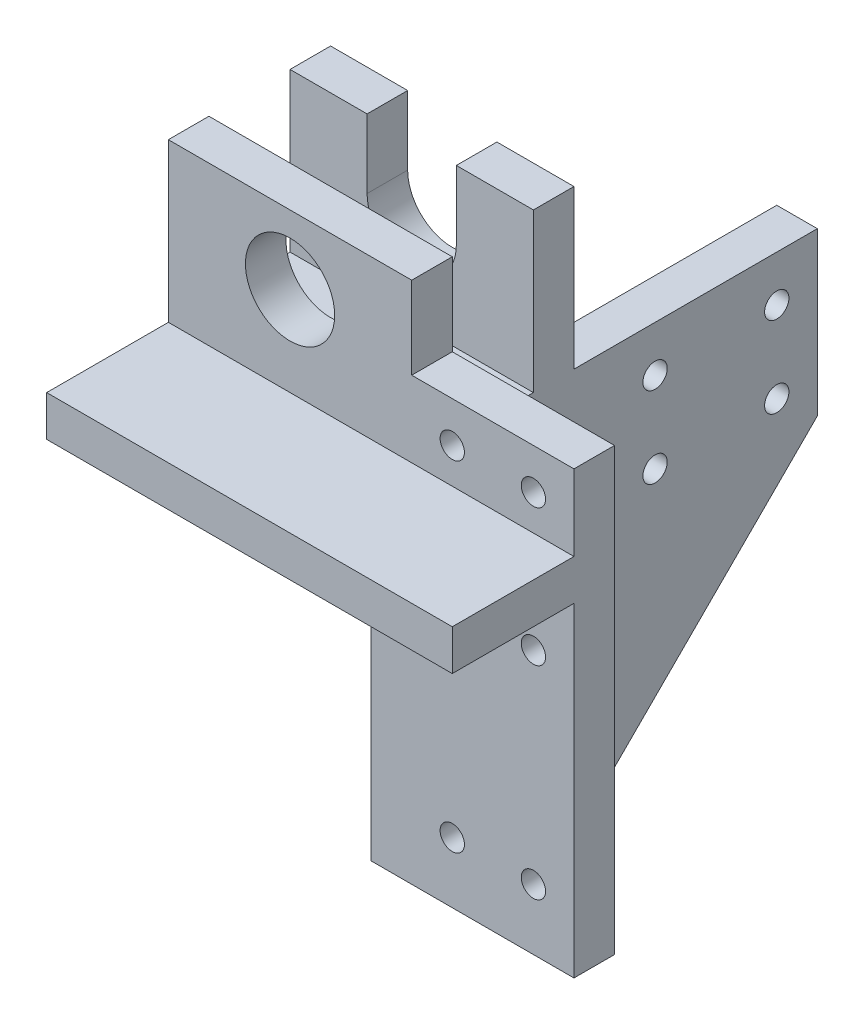
from build123d import *

# Parameters (mm, degrees)
BOSS_EXTRUDE1_DEPTH = 10
BOSS_EXTRUDE2_DEPTH = 80
SKETCH3_W           = 40
SKETCH3_H           = 10
BOSS_EXTRUDE3_DEPTH = 18.71
SKETCH4_W           = 10
SKETCH4_H           = 90
BOSS_EXTRUDE4_DEPTH = 50
CUT_EXTRUDE1_REACH  = 162.624
SKETCH6_R           = 3.5
CUT_EXTRUDE2_DEPTH  = 10
CUT_EXTRUDE3_DEPTH  = 10
SKETCH8_R           = 3
CUT_EXTRUDE4_DEPTH  = 10
SKETCH9_R           = 3
CUT_EXTRUDE5_DEPTH  = 10
SKETCH10_W          = 60
SKETCH10_H          = 10
BOSS_EXTRUDE5_DEPTH = 39
SKETCH11_R          = 11
CUT_EXTRUDE6_DEPTH  = 10
CUT_EXTRUDE7_START  = -10
CUT_EXTRUDE7_DEPTH  = 10


with BuildPart() as part:
    # Sketch1 → Boss-Extrude1 (new body)
    with BuildSketch(Plane(origin=(0, 0, 0), x_dir=(1, 0, 0), z_dir=(0, 1, 0))):
        Polygon((0, 0), (100, 0), (100, 40), (60, 40), (60, 80), (0, 80), align=None)
    extrude(amount=BOSS_EXTRUDE1_DEPTH)

    # Sketch2 → Boss-Extrude2 (add)
    with BuildSketch(Plane.XZ):
        Polygon((60, -40), (100, -40), (100, -30), (50, -30), (50, -80), (60, -80), align=None)
    extrude(amount=BOSS_EXTRUDE2_DEPTH)

    # Sketch3 → Boss-Extrude3 (add)
    with BuildSketch(Plane(origin=(0, 10, 0), x_dir=(1, 0, 0), z_dir=(0, 1, 0))):
        with Locations((80, 35)):
            Rectangle(SKETCH3_W, SKETCH3_H)
    extrude(amount=BOSS_EXTRUDE3_DEPTH)

    # Sketch4 → Boss-Extrude4 (add)
    with BuildSketch(Plane(origin=(0, 0, -80), x_dir=(-1, 0, 0), z_dir=(0, 0, -1))):
        with Locations((-55, -35)):
            Rectangle(SKETCH4_W, SKETCH4_H)
    extrude(amount=BOSS_EXTRUDE4_DEPTH)

    # Sketch5 → Cut-Extrude1 (cut, up to next)
    with BuildSketch(Plane.ZY.offset(-50), mode=Mode.PRIVATE) as cut_extrude1_sk1:
        Polygon((-80, -80), (-130, -30), (-130, -80), align=None)
    cut_extrude1_tool1 = extrude(cut_extrude1_sk1.sketch, amount=-CUT_EXTRUDE1_REACH, mode=Mode.PRIVATE) & part.part
    add(cut_extrude1_tool1.solids().sort_by_distance((50, -63.333333, -113.333333))[0], mode=Mode.SUBTRACT)

    # Sketch6 → Cut-Extrude2 (cut)
    with BuildSketch(Plane(origin=(0, 10, 0), x_dir=(1, 0, 0), z_dir=(0, 1, 0))):
        with Locations((7, 50)):
            Circle(SKETCH6_R)
        with Locations((53, 50)):
            Circle(SKETCH6_R)
    extrude(amount=-CUT_EXTRUDE2_DEPTH, mode=Mode.SUBTRACT)

    # Sketch7 → Cut-Extrude3 (cut)
    with BuildSketch(Plane.ZY.offset(-50)):
        Polygon((-50, 0), (-43, 0), (-43, -6), (-57, -6), (-57, 0), align=None)
    extrude(amount=-CUT_EXTRUDE3_DEPTH, mode=Mode.SUBTRACT)

    # Sketch8 → Cut-Extrude4 (cut)
    with BuildSketch(Plane.XY.offset(-30)):
        with Locations((70, 18.71)):
            Circle(SKETCH8_R)
        with Locations((90, 18.71)):
            Circle(SKETCH8_R)
        with Locations((70, -15)):
            Circle(SKETCH8_R)
        with Locations((90, -15)):
            Circle(SKETCH8_R)
        with Locations((90, -65)):
            Circle(SKETCH8_R)
        with Locations((70, -65)):
            Circle(SKETCH8_R)
    extrude(amount=-CUT_EXTRUDE4_DEPTH, mode=Mode.SUBTRACT)

    # Sketch9 → Cut-Extrude5 (cut)
    with BuildSketch(Plane.ZY.offset(-50)):
        with Locations((-50, -15)):
            Circle(SKETCH9_R)
        with Locations((-70, -15)):
            Circle(SKETCH9_R)
        with Locations((-70, -65)):
            Circle(SKETCH9_R)
        with Locations((-50, -65)):
            Circle(SKETCH9_R)
        with Locations((-90, -1.3)):
            Circle(SKETCH9_R)
        with Locations((-120, -1.3)):
            Circle(SKETCH9_R)
        with Locations((-90, -21.3)):
            Circle(SKETCH9_R)
        with Locations((-120, -21.3)):
            Circle(SKETCH9_R)
    extrude(amount=-CUT_EXTRUDE5_DEPTH, mode=Mode.SUBTRACT)

    # Sketch10 → Boss-Extrude5 (add)
    with BuildSketch(Plane(origin=(0, 10, 0), x_dir=(1, 0, 0), z_dir=(0, 1, 0))):
        with Locations((30, 35)):
            Rectangle(SKETCH10_W, SKETCH10_H)
        with Locations((30, 65)):
            Rectangle(SKETCH10_W, SKETCH10_H)
    extrude(amount=BOSS_EXTRUDE5_DEPTH)

    # Sketch11 → Cut-Extrude6 (cut)
    with BuildSketch(Plane.XY.offset(-30)):
        with Locations((30, 32)):
            Circle(SKETCH11_R)
    extrude(amount=-CUT_EXTRUDE6_DEPTH, mode=Mode.SUBTRACT)

    # Sketch12 → Cut-Extrude7 (cut)
    with BuildSketch(Plane(origin=(0, 0, -70), x_dir=(-1, 0, 0), z_dir=(0, 0, -1)).offset(CUT_EXTRUDE7_START)):
        with BuildLine():
            Line((-19, 49), (-19, 32))
            ThreePointArc((-19, 32), (-30, 21), (-41, 32))
            Line((-41, 32), (-41, 49))
            Line((-41, 49), (-19, 49))
        make_face()
    extrude(amount=CUT_EXTRUDE7_DEPTH, mode=Mode.SUBTRACT)


solid = part.part
